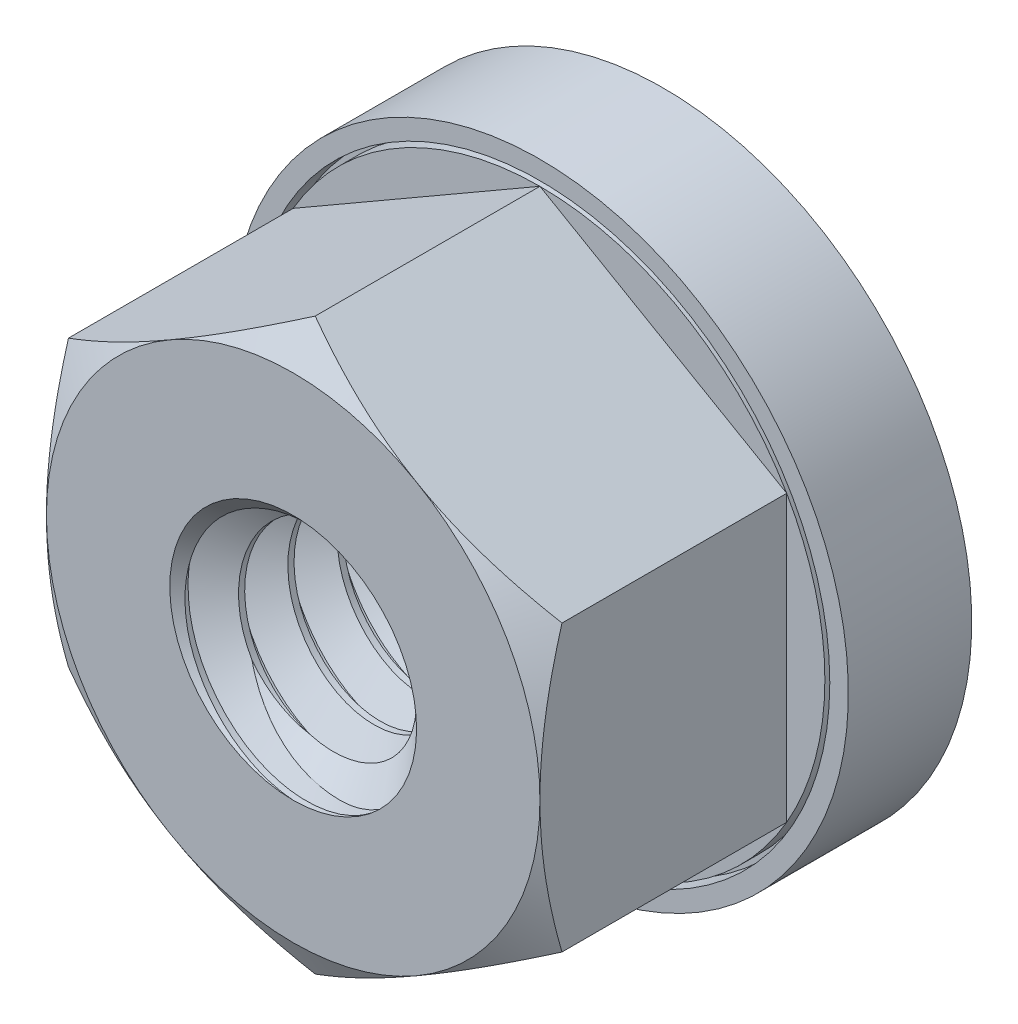
from build123d import *

# Parameters (mm, degrees)
EXTRUDE1_DEPTH          = 9.525
SKETCH2_OUTSIDE_W       = 69.58
SKETCH2_OUTSIDE_H       = 71.544
SKETCH2_OUTSIDE_R       = 6.35
CUT_EXTRUDE1_DEPTH      = 14.594537812
CUT_EXTRUDE1_DRAFT      = -60
SKETCH13_R              = 7.9375
EXTRUDE3_DEPTH          = 3.175
SKETCH4_R               = 3.175
CUT_EXTRUDE3_DEPTH      = 15.721869362
SKETCH12_R              = 3.175
SKETCH12_R_2            = 2.350110803
EXTRUDE2_DEPTH          = 9.525
CUT_SWEEP1_PITCH        = 1.27
SKETCH14_R              = 7.459348419
SKETCH14_R_2            = 7.332348419
CUT_EXTRUDE_THIN1_DEPTH = 0.508


with BuildPart() as part:
    # Sketch1 → Extrude1 (new body)
    with BuildSketch(Plane.XY):
        Polygon((0, 7.332348419), (-6.35, 3.666174209), (-6.35, -3.666174209), (0, -7.332348419), (6.35, -3.666174209), (6.35, 3.666174209), align=None)
    extrude(amount=-EXTRUDE1_DEPTH)


with BuildPart() as cut_extrude1_tool:
    # Sketch2 outside → Cut-Extrude1 (with draft: the straight prism first)
    with BuildSketch(Plane.XY):
        Rectangle(SKETCH2_OUTSIDE_W, SKETCH2_OUTSIDE_H)
        Circle(SKETCH2_OUTSIDE_R, mode=Mode.SUBTRACT)
    extrude(amount=-CUT_EXTRUDE1_DEPTH)
    # Cut-Extrude1: the draft: its side faces are tilted about the plane it starts from
    cut_extrude1_sides = [cut_extrude1_tool.faces().sort_by_distance(p)[0] for p in [
        (0, -35.772, -7.297268906),
        (34.79, 0, -7.297268906),
        (0, 35.772, -7.297268906),
        (-34.79, 0, -7.297268906),
        (-6.35, 0, -7.297268906),
    ]]
    draft(cut_extrude1_sides, Plane.XY, CUT_EXTRUDE1_DRAFT)


with BuildPart() as part_1:
    add(part.part)

    # Cut-Extrude1: cut by cut_extrude1_tool
    add(cut_extrude1_tool.part, mode=Mode.SUBTRACT)

    # Sketch13 → Extrude3 (add)
    with BuildSketch(Plane(origin=(0, 0, -9.525), x_dir=(-1, 0, 0), z_dir=(0, 0, -1))):
        Circle(SKETCH13_R)
    extrude(amount=-EXTRUDE3_DEPTH)

    # Sketch4 → Cut-Extrude3 (cut, through all)
    with BuildSketch(Plane.XY):
        Circle(SKETCH4_R)
    extrude(amount=-CUT_EXTRUDE3_DEPTH, mode=Mode.SUBTRACT)

    # Sketch12 → Extrude2 (add)
    with BuildSketch(Plane.XY):
        Circle(SKETCH12_R)
        Circle(SKETCH12_R_2, mode=Mode.SUBTRACT)
    extrude(amount=-EXTRUDE2_DEPTH)

    # Cut-Sweep1: the profile of Sketch9 profile screwed along a right-hand helix of 8.5 turns, 6 arcs to a turn; built about Z, then put on its axis
    cut_sweep1_z = Axis((0, 0, 0), (0, 0, 1))
    cut_sweep1_corners = [(3.175, 0, -0.635), (3.175, 0, -0.47625), (2.349810803, 0, 0.000173205), (2.349810803, 0, -1.111423205)]
    with BuildLine(mode=Mode.PRIVATE) as cut_sweep1_profile:
        Line(cut_sweep1_corners[0], cut_sweep1_corners[1])
        Line(cut_sweep1_corners[1], cut_sweep1_corners[2])
        Line(cut_sweep1_corners[2], cut_sweep1_corners[3])
        Line(cut_sweep1_corners[3], cut_sweep1_corners[0])
    cut_sweep1_cap = Face(cut_sweep1_profile.wire())
    cut_sweep1_turn_angles = [0, 30, 60, 90, 120, 150, 180, 210, 240, 270, 300, 330, 360]
    cut_sweep1_turn_weights = [1, 0.8660254037844387, 1, 0.8660254037844387, 1, 0.8660254037844387, 1, 0.8660254037844387, 1, 0.8660254037844387, 1, 0.8660254037844387, 1]
    cut_sweep1_turn_rails = [Edge.make_bspline([Vector(p[0], p[1], 0).rotate(cut_sweep1_z, cut_sweep1_turn_angles[k]) / cut_sweep1_turn_weights[k] + Vector(0, 0, p[2] + CUT_SWEEP1_PITCH * cut_sweep1_turn_angles[k] / 360) for k in range(13)], [0, 0, 0, 1, 1, 2, 2, 3, 3, 4, 4, 5, 5, 6, 6, 6], 2, cut_sweep1_turn_weights) for p in cut_sweep1_corners]
    cut_sweep1_turn_sides = [Face.make_surface_from_curves(cut_sweep1_turn_rails[p[0]], cut_sweep1_turn_rails[p[1]]) for p in [(0, 1), (1, 2), (2, 3), (3, 0)]]
    cut_sweep1_last_angles = [2880, 2910, 2940, 2970, 3000, 3030, 3060]
    cut_sweep1_last_weights = [1, 0.8660254037844387, 1, 0.8660254037844387, 1, 0.8660254037844466, 1]
    cut_sweep1_last_rails = [Edge.make_bspline([Vector(p[0], p[1], 0).rotate(cut_sweep1_z, cut_sweep1_last_angles[k]) / cut_sweep1_last_weights[k] + Vector(0, 0, p[2] + CUT_SWEEP1_PITCH * cut_sweep1_last_angles[k] / 360) for k in range(7)], [0, 0, 0, 1, 1, 2, 2, 3, 3, 3], 2, cut_sweep1_last_weights) for p in cut_sweep1_corners]
    cut_sweep1_last_sides = [Face.make_surface_from_curves(cut_sweep1_last_rails[p[0]], cut_sweep1_last_rails[p[1]]) for p in [(0, 1), (1, 2), (2, 3), (3, 0)]]
    cut_sweep1 = Plane(origin=(0, 0, 0), x_dir=(0, 1, 0), z_dir=(0, 0, -1)) * Solid(Shell([*[p.moved(Location((0, 0, CUT_SWEEP1_PITCH * i))) for i in range(8) for p in cut_sweep1_turn_sides], *cut_sweep1_last_sides, cut_sweep1_cap, cut_sweep1_cap.rotate(cut_sweep1_z, 3060).moved(Location((0, 0, CUT_SWEEP1_PITCH * 3060 / 360)))]))
    add(cut_sweep1, mode=Mode.SUBTRACT)

    # Cut-Extrude6 cone 1 section (through the dimple's axis) → Cut-Extrude6 (revolve, cut)
    with BuildSketch(Plane(origin=(0, 0, 0), x_dir=(0, -1, 0), z_dir=(1, 0, 0))):
        Polygon((0, 0), (3.175, 0), (0, 3.175), align=None)
    revolve(axis=Axis((0, 0, 0), (0, 0, -1)), mode=Mode.SUBTRACT)

    # Cut-Extrude7 cone 1 section (through the dimple's axis) → Cut-Extrude7 (revolve, cut)
    with BuildSketch(Plane(origin=(0, 0, -9.525), x_dir=(0, 1, 0), z_dir=(1, 0, 0))):
        Polygon((0, 0), (3.175, 0), (0, 3.175), align=None)
    revolve(axis=Axis((0, 0, -9.525), (0, 0, 1)), mode=Mode.SUBTRACT)

    # Sketch14 → Cut-Extrude-Thin1 (cut)
    with BuildSketch(Plane.XY.offset(-6.35)):
        Circle(SKETCH14_R)
        Circle(SKETCH14_R_2, mode=Mode.SUBTRACT)
    extrude(amount=-CUT_EXTRUDE_THIN1_DEPTH, mode=Mode.SUBTRACT)


solid = part_1.part
